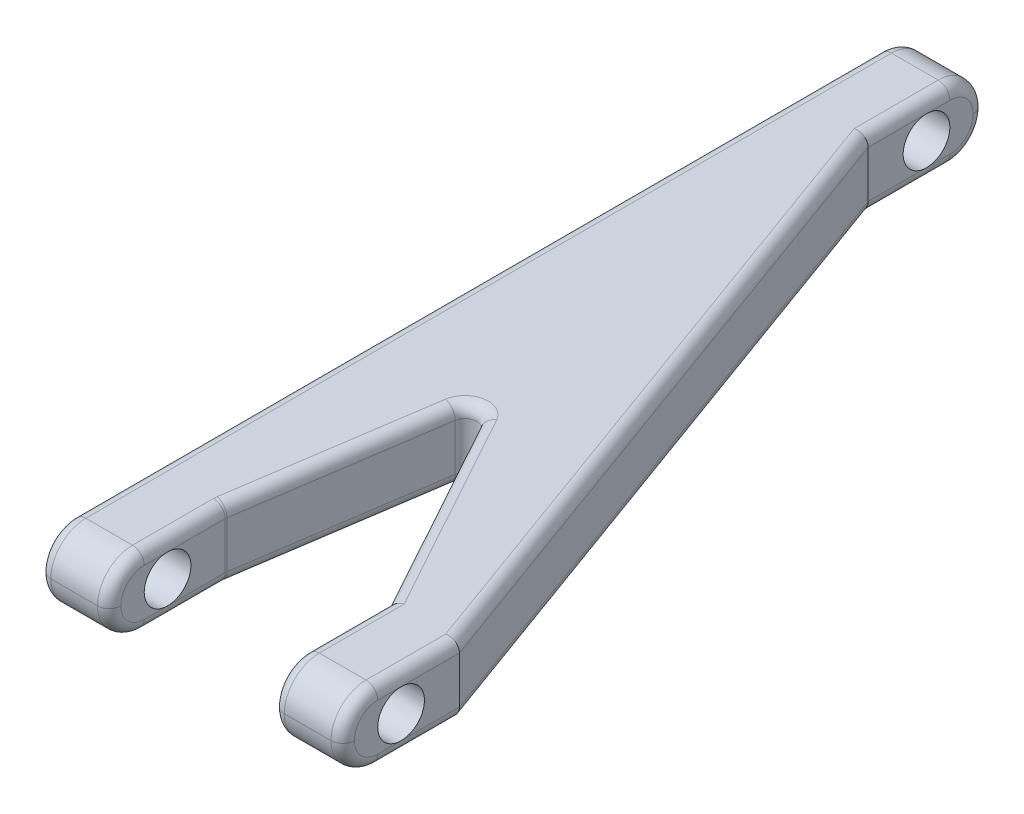
from build123d import *

# Parameters (mm, degrees)
BOSS_EXTRUDE1_DEPTH = 6
SKETCH3_R           = 2
CUT_EXTRUDE1_DEPTH  = 55.481648286
SKETCH4_R           = 2
CUT_EXTRUDE2_DEPTH  = 52.886896226
FILLET1_R           = 3
FILLET2_R           = 1


with BuildPart() as part:
    # Sketch2 → Boss-Extrude1 (new body)
    with BuildSketch(Plane(origin=(0, 0, 0), x_dir=(1, 0, 0), z_dir=(0, 1, 0))):
        Polygon((-21, 17.5), (-21, -47.5), (-15, -47.5), (-15, -37.5), (-12, -17.5), (-1, -37.5), (-1, -47.5), (5, -47.5), (5, -37.5), (-15, 17.5), (-15, 27.5), (-21, 27.5), align=None)
    extrude(amount=BOSS_EXTRUDE1_DEPTH)

    # Sketch3 → Cut-Extrude1 (cut, through all)
    with BuildSketch(Plane(origin=(5, 0, 0), x_dir=(0, 0, -1), z_dir=(1, 0, 0))):
        with Locations((-42.5, 3)):
            Circle(SKETCH3_R)
    extrude(amount=-CUT_EXTRUDE1_DEPTH, mode=Mode.SUBTRACT)

    # Sketch4 → Cut-Extrude2 (cut, through all)
    with BuildSketch(Plane(origin=(-15, 0, 0), x_dir=(0, 0, -1), z_dir=(1, 0, 0))):
        with Locations((22.5, 3)):
            Circle(SKETCH4_R)
    extrude(amount=-CUT_EXTRUDE2_DEPTH, mode=Mode.SUBTRACT)

    # Fillet1
    fillet1_edges = [part.edges().sort_by_distance(p)[0] for p in [
        (-18, 0, -27.5),
        (-18, 6, -27.5),
        (2, 0, 47.5),
        (2, 6, 47.5),
        (-18, 0, 47.5),
        (-18, 6, 47.5),
    ]]
    fillet(fillet1_edges, radius=FILLET1_R - 0.0001)  # a hair under: the kernel refuses the full size

    # Fillet2
    fillet2_edges = [part.edges().sort_by_distance(p)[0] for p in [
        (-15, 0, -21.00005),
        (-5, 0, 10),
        (-1, 0, 41.00005),
        (-6.5, 0, 27.5),
        (-13.5, 0, 27.5),
        (-13.5, 6, 27.5),
        (-12, 3, 17.5),
        (-15, 3, 37.5),
        (-6.5, 6, 27.5),
        (-1, 6, 41.00005),
        (-5, 6, 10),
        (-15, 6, -21.00005),
        (-21, 0, 10),
        (-21, 6, 10),
        (-21, 5.121349633, 46.621349633),
        (-21, 0.878650367, 46.621349633),
        (-21, 5.121349633, -26.621349633),
        (-21, 0.878650367, -26.621349633),
        (5, 0, 41.00005),
        (-15, 0, 41.00005),
        (-15, 5.121349633, -26.621349633),
        (-15, 0.878650367, -26.621349633),
        (-15, 6, 41.00005),
        (5, 6, 41.00005),
        (5, 5.121349633, 46.621349633),
        (5, 0.878650367, 46.621349633),
        (-1, 5.121349633, 46.621349633),
        (-1, 0.878650367, 46.621349633),
        (-15, 5.121349633, 46.621349633),
        (-15, 0.878650367, 46.621349633),
    ]]
    fillet(fillet2_edges, radius=FILLET2_R - 0.0001)  # a hair under: the kernel refuses the full size


solid = part.part
